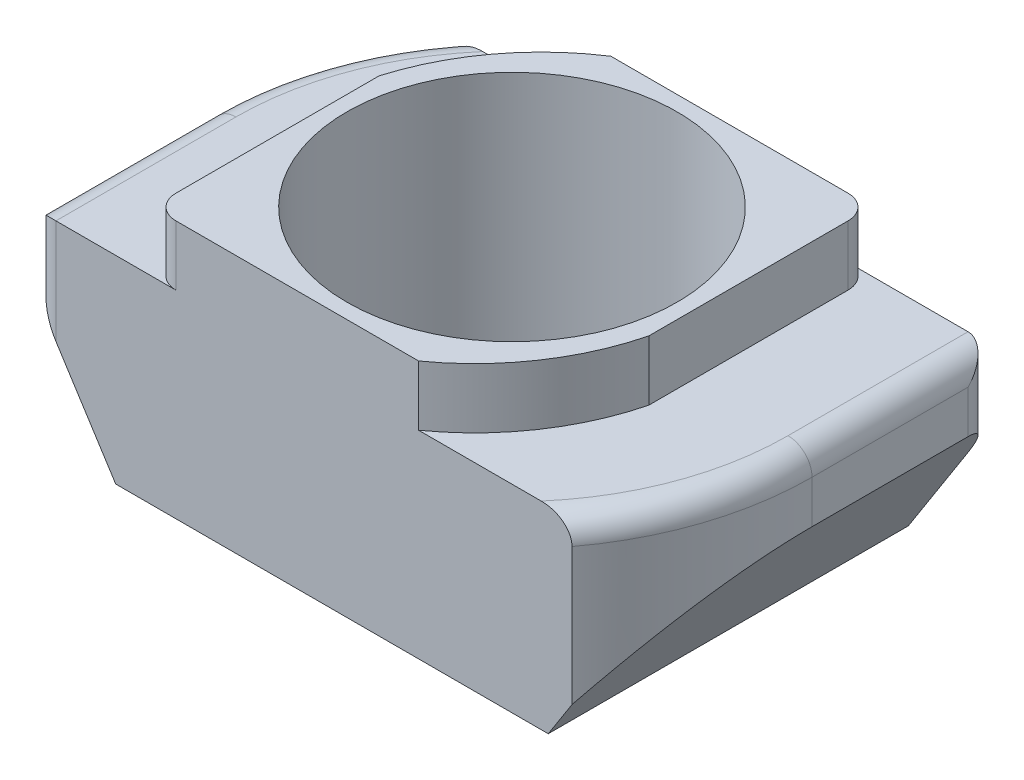
from build123d import *

# Parameters (mm, degrees)
BOSS_EXTRUDE1_DEPTH = 3.3
BOSS_EXTRUDE2_DEPTH = 1
SKETCH4_R           = 2.75
CUT_EXTRUDE1_DEPTH  = 8.244998275
CUT_EXTRUDE2_DEPTH  = 9.91571646
FILLET1_R           = 0.4


with BuildPart() as part:
    # Sketch1 → Boss-Extrude1 (new body)
    with BuildSketch(Plane(origin=(0, 0, 0), x_dir=(1, 0, 0), z_dir=(0, 1, 0))):
        with BuildLine():
            Line((-5, -3), (4, -3))
            ThreePointArc((4, -3), (4.74341641, -1.581139071), (5, -5.07e-07))
            Line((5, -5.07e-07), (5, 3))
            Line((5, 3), (-4, 3))
            ThreePointArc((-4, 3), (-4.74341641, 1.581139071), (-5, 5.07e-07))
            Line((-5, 5.07e-07), (-5, -3))
        make_face()
    extrude(amount=BOSS_EXTRUDE1_DEPTH)

    # Sketch3 → Boss-Extrude2 (add)
    with BuildSketch(Plane(origin=(0, 3.3, 0), x_dir=(1, 0, 0), z_dir=(0, 1, 0))):
        with BuildLine():
            Line((-3, -3), (1.443496021, -3))
            ThreePointArc((1.443496021, -3), (2.424601601, -1.998754321), (3, -0.720482929))
            Line((3, -0.720482929), (3, 3))
            Line((3, 3), (-1.352396976, 3))
            ThreePointArc((-1.352396976, 3), (-2.373272189, 2.039336237), (-3, 0.785433003))
            Line((-3, 0.785433003), (-3, -3))
        make_face()
    extrude(amount=BOSS_EXTRUDE2_DEPTH)

    # Sketch4 → Cut-Extrude1 (cut, through all)
    with BuildSketch(Plane(origin=(0, 4.3, 0), x_dir=(1, 0, 0), z_dir=(0, 1, 0))):
        Circle(SKETCH4_R)
    extrude(amount=-CUT_EXTRUDE1_DEPTH, mode=Mode.SUBTRACT)

    # Sketch5 → Cut-Extrude2 (cut, through all)
    with BuildSketch(Plane.XY.offset(3)):
        Polygon((4, 0), (5, 0), (5, 2.185994227), (3.604159787, 0), align=None)
        Polygon((-5, 0), (-3.604159787, 0), (-5, 2.185994227), align=None)
    extrude(amount=-CUT_EXTRUDE2_DEPTH, mode=Mode.SUBTRACT)

    # Fillet1
    fillet1_edges = [part.edges().sort_by_distance(p)[0] for p in [
        (5, 2.742997113, -3),
        (-5, 2.742997113, 3),
        (3, 3.8, -3),
        (-3, 3.8, 3),
        (4.74341641, 3.3, 1.581139071),
        (-4.74341641, 3.3, -1.581139071),
        (5, 3.3, -1.499999746),
        (-5, 3.3, 1.499999746),
    ]]
    fillet(fillet1_edges, radius=FILLET1_R)


solid = part.part
